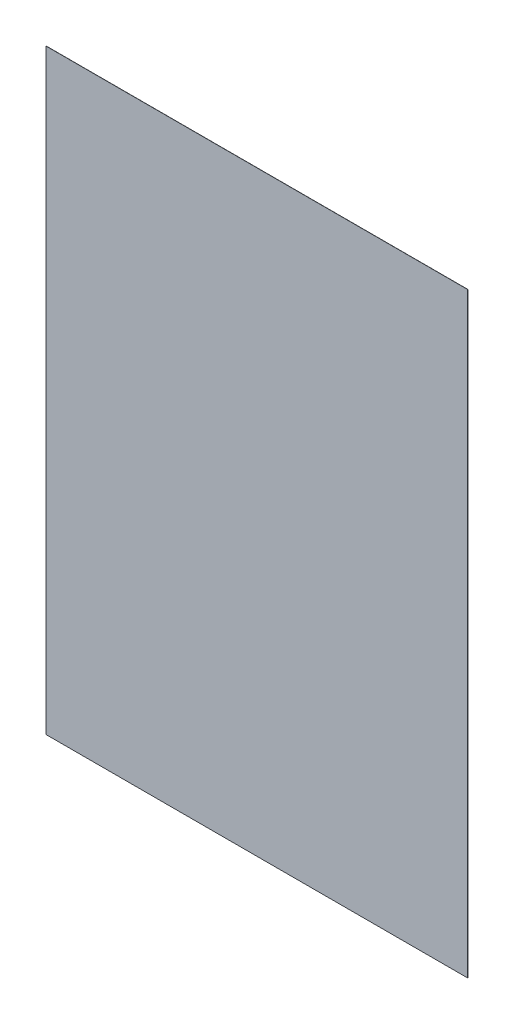
from build123d import *

# Parameters (mm, degrees)
SKETCH_1_W      = 210
SKETCH_1_H      = 297
EXTRUDE_1_DEPTH = 0.1


with BuildPart() as part:
    # 草图1 → 凸台-拉伸1 (new body)
    with BuildSketch(Plane.XY):
        with Locations((105, 148.5)):
            Rectangle(SKETCH_1_W, SKETCH_1_H)
    extrude(amount=EXTRUDE_1_DEPTH)


solid = part.part
